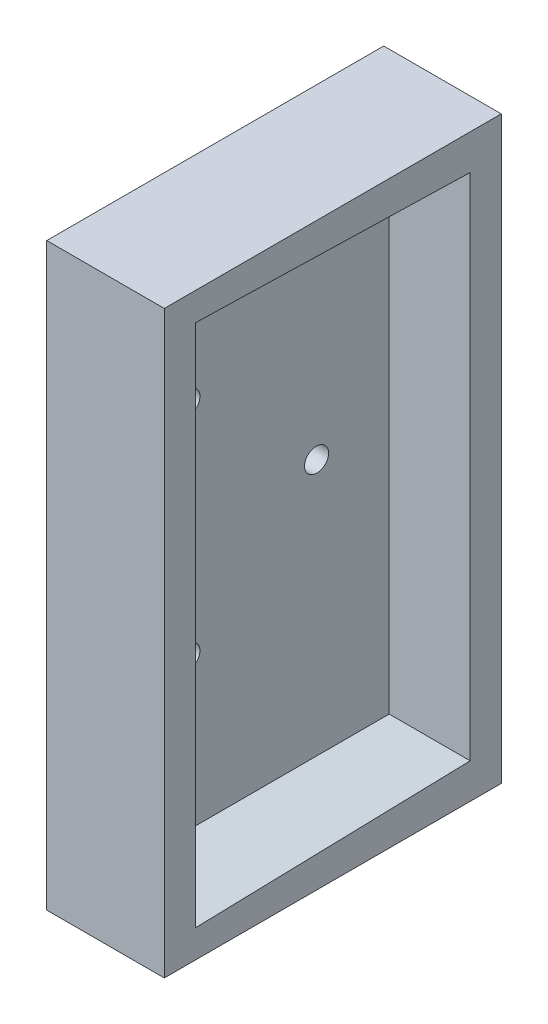
from build123d import *

# Parameters (mm, degrees)
SKETCH1_W           = 129
SKETCH1_H           = 74
BOSS_EXTRUDE1_DEPTH = 39
SKETCH3_R           = 1.5
CUT_EXTRUDE2_DEPTH  = 10
CAVITY1_START       = 3.561625
CAVITY1_DEPTH       = 66.86575
CAVITY1_START_2     = 3
CAVITY1_2_DEPTH     = 123
SKETCH4_W           = 114
SKETCH4_H           = 39
CUT_EXTRUDE3_DEPTH  = 100
SKETCH5_W           = 15
SKETCH5_H           = 74
BOSS_EXTRUDE2_DEPTH = 4


with BuildPart() as part:
    # Sketch1 → Boss-Extrude1 (new body)
    with BuildSketch(Plane.XY):
        with Locations((64.5, 37)):
            Rectangle(SKETCH1_W, SKETCH1_H)
    extrude(amount=-BOSS_EXTRUDE1_DEPTH)

    # Sketch3 → Cut-Extrude2 (cut)
    with BuildSketch(Plane.ZY):
        with Locations((-10, 51.05)):
            Circle(SKETCH3_R)
        with Locations((-10, 22.95)):
            Circle(SKETCH3_R)
        with Locations((-26, 37)):
            Circle(SKETCH3_R)
    extrude(amount=-CUT_EXTRUDE2_DEPTH, mode=Mode.SUBTRACT)

    # Cavity1: read off the stored shape, not the designer's step
    # Cavity1 outline → Cavity1 (cut)
    with BuildSketch(Plane(origin=(0, 0, 0), x_dir=(1, 0, 0), z_dir=(0, 1, 0)).offset(CAVITY1_START)):
        Polygon((124.330201477, 35.035), (4.664798523, 35.035), (3.746, 0), (125.249, 0), align=None)
    extrude(amount=CAVITY1_DEPTH, mode=Mode.SUBTRACT)

    # Cavity1 2 outline → Cavity1 2 (add)
    with BuildSketch(Plane.YZ.offset(CAVITY1_START_2)):
        Polygon((70.427375, 0), (69.505826955, -35.035), (70.427375, -35.035), align=None)
        Polygon((4.483173045, -35.035), (3.561625, 0), (3.561625, -35.035), align=None)
    extrude(amount=CAVITY1_2_DEPTH)

    # Sketch4 → Cut-Extrude3 (cut)
    with BuildSketch(Plane(origin=(0, 74, 0), x_dir=(1, 0, 0), z_dir=(0, 1, 0))):
        with Locations((72, 19.5)):
            Rectangle(SKETCH4_W, SKETCH4_H)
    extrude(amount=-CUT_EXTRUDE3_DEPTH, mode=Mode.SUBTRACT)

    # Sketch5 → Boss-Extrude2 (add)
    with BuildSketch(Plane.XY):
        with Locations((7.5, 37)):
            Rectangle(SKETCH5_W, SKETCH5_H)
    extrude(amount=BOSS_EXTRUDE2_DEPTH)


solid = part.part
